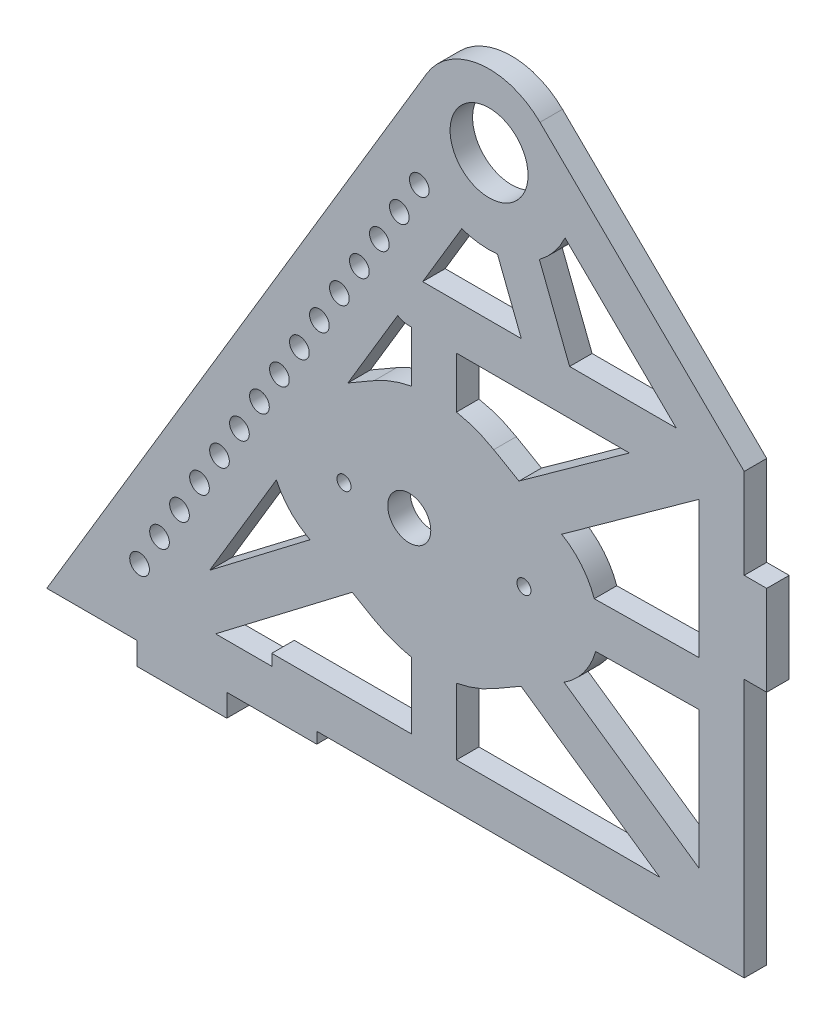
from build123d import *

# Parameters (mm, degrees)
SKETCH2_R               = 11
BOSS_EXTRUDE1_DEPTH     = 6.35
CUT_EXTRUDE2_DEPTH      = 283.224719638
CUT_EXTRUDE2_DEPTH_BACK = 283.224719638
CUT_EXTRUDE3_DEPTH      = 283.224719638
CUT_EXTRUDE3_DEPTH_BACK = 283.224719638
SKETCH6_R               = 1.984375
SKETCH8_R               = 2.778125
CUT_EXTRUDE5_DEPTH      = 283.224719638
CUT_EXTRUDE4_DEPTH      = 50.8


with BuildPart() as part:
    # Sketch2 → Boss-Extrude1 (new body)
    with BuildSketch(Plane.XY):
        with BuildLine():
            Line((50.8, 0), (50.8, 6.35))
            Line((50.8, 6.35), (76.2, 6.35))
            Line((76.2, 6.35), (76.2, 9.525))
            Line((76.2, 9.525), (83.986447759, 9.525))
            Line((83.986447759, 9.525), (196.85, 9.525))
            Line((196.85, 9.525), (196.85, 82.55))
            Line((196.85, 82.55), (203.2, 82.55))
            Line((203.2, 82.55), (203.2, 107.95))
            Line((203.2, 107.95), (196.85, 107.95))
            Line((196.85, 107.95), (196.85, 133.35))
            Line((196.85, 133.35), (139.204596213, 189.884425208))
            ThreePointArc((139.204596213, 189.884425208), (122.208232851, 195.586998388), (107.214428724, 185.75940732))
            Line((107.214428724, 185.75940732), (0, 6.35))
            Line((0, 6.35), (25.4, 6.35))
            Line((25.4, 6.35), (25.4, 0))
            Line((25.4, 0), (50.8, 0))
        make_face()
        with Locations((124.833126, 175.230536)):
            Circle(SKETCH2_R, mode=Mode.SUBTRACT)
    extrude(amount=BOSS_EXTRUDE1_DEPTH)

    # Sketch5 → Cut-Extrude2 (cut, two sides: drawn at the far end of the back side and taken through both)
    with BuildSketch(Plane.XY.offset(6.35).offset(-CUT_EXTRUDE2_DEPTH_BACK)):
        with BuildLine():
            ThreePointArc((107.774174374, 77.336274404), (101.809812982, 68.629819943), (97.344042946, 78.19187276))
            ThreePointArc((97.344042946, 78.19187276), (102.803354213, 80.741537476), (107.774174374, 77.336274404))
        make_face()
    extrude(amount=CUT_EXTRUDE2_DEPTH + CUT_EXTRUDE2_DEPTH_BACK, mode=Mode.SUBTRACT)

    # Sketch6 → Cut-Extrude3 (cut, two sides: drawn at the far end of the back side and taken through both)
    with BuildSketch(Plane(origin=(0, 0, 0), x_dir=(-1, 0, 0), z_dir=(0, 0, -1)).offset(-CUT_EXTRUDE3_DEPTH_BACK)):
        with Locations((-83.883149768, 74.113381171)):
            Circle(SKETCH6_R)
        with Locations((-134.683149768, 74.113381171)):
            Circle(SKETCH6_R)
    extrude(amount=CUT_EXTRUDE3_DEPTH + CUT_EXTRUDE3_DEPTH_BACK, mode=Mode.SUBTRACT)

    # Sketch8 → Cut-Extrude5 (cut, through all)
    with BuildSketch(Plane(origin=(0, 0, 0), x_dir=(-1, 0, 0), z_dir=(0, 0, -1))):
        with Locations((-105.140118089, 157.530916147)):
            Circle(SKETCH8_R)
        with Locations((-99.500048858, 148.092993565)):
            Circle(SKETCH8_R)
        with Locations((-93.859979627, 138.655070983)):
            Circle(SKETCH8_R)
        with Locations((-88.219910396, 129.217148401)):
            Circle(SKETCH8_R)
        with Locations((-82.579841165, 119.77922582)):
            Circle(SKETCH8_R)
        with Locations((-76.939771934, 110.341303238)):
            Circle(SKETCH8_R)
        with Locations((-71.299702703, 100.903380656)):
            Circle(SKETCH8_R)
        with Locations((-65.659633473, 91.465458074)):
            Circle(SKETCH8_R)
        with Locations((-60.019564242, 82.027535492)):
            Circle(SKETCH8_R)
        with Locations((-54.379495011, 72.58961291)):
            Circle(SKETCH8_R)
        with Locations((-48.73942578, 63.151690328)):
            Circle(SKETCH8_R)
        with Locations((-43.099356549, 53.713767746)):
            Circle(SKETCH8_R)
        with Locations((-37.459287318, 44.275845164)):
            Circle(SKETCH8_R)
        with Locations((-31.819218087, 34.837922582)):
            Circle(SKETCH8_R)
        with Locations((-26.179148856, 25.4)):
            Circle(SKETCH8_R)
    extrude(amount=-CUT_EXTRUDE5_DEPTH, mode=Mode.SUBTRACT)

    # Sketch7 → Cut-Extrude4 (cut)
    with BuildSketch(Plane(origin=(0, 0, 0), x_dir=(-1, 0, 0), z_dir=(0, 0, -1))):
        with BuildLine():
            ThreePointArc((-92.405677819, 44.897999253), (-97.505044508, 42.495920228), (-102.933149768, 40.976315821))
            Line((-102.933149768, 40.976315821), (-102.933149768, 22.225))
            Line((-102.933149768, 22.225), (-63.5, 22.225))
            Line((-63.5, 22.225), (-63.5, 19.05))
            Line((-63.5, 19.05), (-47.641846025, 19.05))
            Line((-47.641846025, 19.05), (-86.19055377, 48.488422341))
            Line((-86.19055377, 48.488422341), (-92.405677819, 44.897999253))
        make_face()
        with BuildLine():
            Line((-73.361304065, 55.899768277), (-74.277449866, 55.370518818))
            Line((-74.277449866, 55.370518818), (-45.962310819, 33.747147487))
            Line((-45.962310819, 33.747147487), (-64.79903565, 65.267957495))
            ThreePointArc((-64.79903565, 65.267957495), (-68.35675429, 59.922680867), (-73.361304065, 55.899768277))
        make_face()
        with BuildLine():
            Line((-102.933149768, 121.66695652), (-102.933149768, 107.25044652))
            ThreePointArc((-102.933149768, 107.25044652), (-97.505044508, 105.730842114), (-92.405677819, 103.328763089))
            Line((-92.405677819, 103.328763089), (-84.980763043, 99.039454422))
            Line((-84.980763043, 99.039454422), (-99.040206401, 122.566104988))
            ThreePointArc((-99.040206401, 122.566104988), (-100.608001771, 121.89586972), (-102.297616042, 121.66695652))
            Line((-102.297616042, 121.66695652), (-102.933149768, 121.66695652))
        make_face()
        with BuildLine():
            Line((-115.633149768, 22.225), (-115.633149768, 40.976315821))
            ThreePointArc((-115.633149768, 40.976315821), (-121.061255028, 42.495920228), (-126.160621716, 44.897999253))
            Line((-126.160621716, 44.897999253), (-133.866195799, 49.349442358))
            Line((-133.866195799, 49.349442358), (-173.00254035, 22.225))
            Line((-173.00254035, 22.225), (-115.633149768, 22.225))
        make_face()
        with BuildLine():
            ThreePointArc((-126.160621716, 103.328763089), (-121.061255028, 105.730842114), (-115.633149768, 107.25044652))
            Line((-115.633149768, 107.25044652), (-115.633149768, 121.66695652))
            Line((-115.633149768, 121.66695652), (-164.462773469, 121.66695652))
            Line((-164.462773469, 121.66695652), (-133.280284086, 99.215796082))
            Line((-133.280284086, 99.215796082), (-126.160621716, 103.328763089))
        make_face()
        with BuildLine():
            Line((-184.15, 29.951031396), (-146.006812507, 56.387140909))
            ThreePointArc((-146.006812507, 56.387140909), (-151.563885262, 61.564050478), (-154.920220171, 68.377013582))
            Line((-154.920220171, 68.377013582), (-184.15, 68.770403193))
            Line((-184.15, 68.770403193), (-184.15, 29.951031396))
        make_face()
        with BuildLine():
            Line((-133.935623005, 134.36695652), (-106.092353634, 134.36695652))
            Line((-106.092353634, 134.36695652), (-117.120237583, 152.820686552))
            ThreePointArc((-117.120237583, 152.820686552), (-122.0985457, 151.688826831), (-127.203749259, 151.649396389))
            Line((-127.203749259, 151.649396389), (-133.935623005, 134.36695652))
        make_face()
        with BuildLine():
            ThreePointArc((-154.532818161, 81.072949858), (-150.927365776, 87.476403954), (-145.339192743, 92.248807268))
            Line((-145.339192743, 92.248807268), (-184.15, 120.192299841))
            Line((-184.15, 120.192299841), (-184.15, 81.47097826))
            ThreePointArc((-184.15, 81.47097826), (-184.107272097, 81.470834505), (-184.064546129, 81.470403245))
            Line((-184.064546129, 81.470403245), (-154.532818161, 81.072949858))
        make_face()
        with BuildLine():
            Line((-177.675213837, 134.36695652), (-147.565075979, 134.36695652))
            Line((-147.565075979, 134.36695652), (-139.037679814, 156.258961186))
            ThreePointArc((-139.037679814, 156.258961186), (-143.207115529, 160.261016676), (-146.28395025, 165.153227877))
            Line((-146.28395025, 165.153227877), (-177.675213837, 134.36695652))
        make_face()
    extrude(amount=-CUT_EXTRUDE4_DEPTH, mode=Mode.SUBTRACT)


solid = part.part
